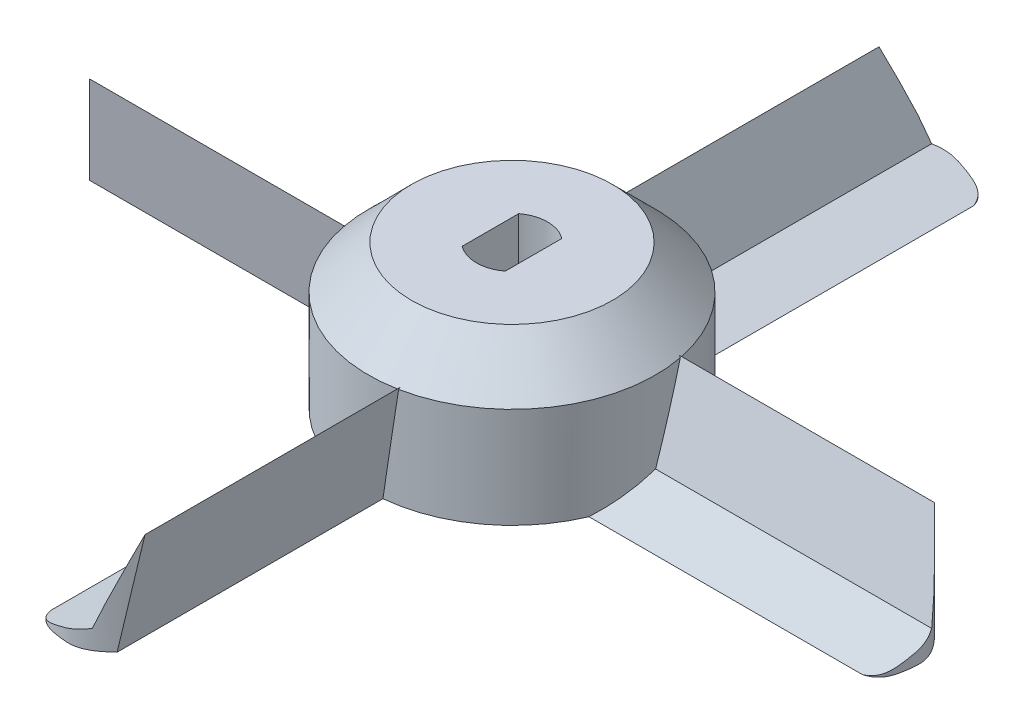
from build123d import *

# Parameters (mm, degrees)
SKETCH1_R           = 10
BOSS_EXTRUDE2_DEPTH = 10
CIRPATTERN1_COUNT   = 4
CUT_EXTRUDE3_DEPTH  = 6.15
CUT_EXTRUDE4_DEPTH  = 8.45
CIRPATTERN2_COUNT   = 4
CHAMFER1_SIZE       = 3


with BuildPart() as part:
    # Sketch1 → Boss-Extrude2 (new body)
    with BuildSketch(Plane(origin=(0, 0, 0), x_dir=(1, 0, 0), z_dir=(0, 1, 0))):
        with Locations(Location((0, 0, 0), (0, 0, 270))):
            Circle(SKETCH1_R)
    extrude(amount=BOSS_EXTRUDE2_DEPTH)

    # Sketch2 → Loft1 section 0
    with BuildSketch(Plane.XY.offset(8)):
        with BuildLine():
            Line((0, 1.334072036), (1.933158154, 7.086396301))
            Line((1.933158154, 7.086396301), (0.966579077, 0))
            Line((0.966579077, 0), (-3.866316309, 0))
            Line((-3.866316309, 0), (0, 1.334072036))
        make_face()
    # Sketch3 → Loft1 section 1
    with BuildSketch(Plane.XY.offset(30)):
        with BuildLine():
            Line((0, 1.334072036), (1.933158154, 7.086396301))
            Line((1.933158154, 7.086396301), (0.966579077, 0))
            Line((0.966579077, 0), (-3.866316309, 0))
            Line((-3.866316309, 0), (0, 1.334072036))
        make_face()
    loft1 = loft()

    # CirPattern1: Loft1 ×4 about axis
    cirpattern1_axis = Axis((0, 0, 0), (0, 1, 0))
    for i in range(1, CIRPATTERN1_COUNT):
        add(loft1.rotate(cirpattern1_axis, i * 360 / CIRPATTERN1_COUNT))

    # Sketch8 → Cut-Extrude3 (cut)
    with BuildSketch(Plane(origin=(0, 10, 0), x_dir=(1, 0, 0), z_dir=(0, 1, 0))):
        with BuildLine():
            Line((1.5, 1.968660712), (1.5, -1.968660712))
            ThreePointArc((1.5, -1.968660712), (0, -2.475), (-1.5, -1.968660712))
            Line((-1.5, -1.968660712), (-1.5, 1.968660712))
            ThreePointArc((-1.5, 1.968660712), (0, 2.475), (1.5, 1.968660712))
        make_face()
    extrude(amount=-CUT_EXTRUDE3_DEPTH, mode=Mode.SUBTRACT)

    # Sketch9 → Cut-Extrude4 (cut)
    with BuildSketch(Plane.XZ):
        with BuildLine():
            Line((28.274704093, 3.866316309), (30.023429762, 3.866316309))
            Line((30.023429762, 3.866316309), (30.023429762, -1.933158154))
            Line((30.023429762, -1.933158154), (27.489632408, -1.933158154))
            add(Edge.make_bspline(
                [(28.274704093, 3.866316309), (29.251563836, 3.579912726), (29.503721472, 2.469841159), (29.781293332, 0.089495711), (28.257519324, -1.153109295), (27.489632408, -1.933158154)],
                knots=[0, 0, 0, 0, 0.329035363, 0.48426931, 1, 1, 1, 1], degree=3))
        make_face()
    cut_extrude4 = extrude(amount=-CUT_EXTRUDE4_DEPTH, mode=Mode.SUBTRACT)

    # CirPattern2: Cut-Extrude4 ×4 about axis
    cirpattern2_axis = Axis((0, 10, 0), (0, 1, 0))
    for i in range(1, CIRPATTERN2_COUNT):
        add(cut_extrude4.rotate(cirpattern2_axis, i * 360 / CIRPATTERN2_COUNT), mode=Mode.SUBTRACT)

    # Chamfer1
    # the kernel refuses this chamfer: 3 mm, written as the material it takes off along each edge
    with BuildSketch(Plane(origin=(0, 10, 0), x_dir=(0, 0, 1), z_dir=(-1, 0, 0))) as chamfer1_piece_1_section:
        Polygon((10, -CHAMFER1_SIZE), (10 - CHAMFER1_SIZE, 0), (10, 0), align=None)
    chamfer1_piece_1 = revolve(axis=Axis((0, 10, 0), (0, 1, 0)), mode=Mode.PRIVATE)
    chamfer1_piece_1 = split(chamfer1_piece_1, bisect_by=Plane(origin=(2.324578556, 8.251110666, 8.890331171), z_dir=(-0.947903464475993, 0.3185577216681616, 0)), keep=Keep.TOP, mode=Mode.PRIVATE)
    chamfer1_piece_1 = split(chamfer1_piece_1, bisect_by=Plane(origin=(-2.324578556, 8.251110666, 8.890331171), z_dir=(0.947903464475993, 0.3185577216681616, 0)), keep=Keep.TOP, mode=Mode.PRIVATE)
    add(chamfer1_piece_1, mode=Mode.SUBTRACT)
    with BuildSketch(Plane(origin=(0, 10, 0), x_dir=(0, 0, 1), z_dir=(-1, 0, 0))) as chamfer1_piece_2_section:
        Polygon((10, -CHAMFER1_SIZE), (10 - CHAMFER1_SIZE, 0), (10, 0), align=None)
    chamfer1_piece_2 = revolve(axis=Axis((0, 10, 0), (0, 1, 0)), mode=Mode.PRIVATE)
    chamfer1_piece_2 = split(chamfer1_piece_2, bisect_by=Plane(origin=(-1.927187537, 7.042623199, 9.791355143), z_dir=(0.9908254446191594, 0.13514783866287053, 0)), keep=Keep.TOP, mode=Mode.PRIVATE)
    chamfer1_piece_2 = split(chamfer1_piece_2, bisect_by=Plane(origin=(-1.922954088, 3.507226982, -0.730322564), z_dir=(0, 0.3185577216681616, 0.947903464475993)), keep=Keep.TOP, mode=Mode.PRIVATE)
    chamfer1_piece_2 = split(chamfer1_piece_2, bisect_by=Plane(origin=(-1.919079209, 7.044502852, 9.791355143), z_dir=(-0.947903464475993, -0.3185577216681616, 0)), keep=Keep.TOP, mode=Mode.PRIVATE)
    add(chamfer1_piece_2, mode=Mode.SUBTRACT)
    with BuildSketch(Plane(origin=(0, 10, 0), x_dir=(0, 0, 1), z_dir=(-1, 0, 0))) as chamfer1_piece_3_section:
        Polygon((10, -CHAMFER1_SIZE), (10 - CHAMFER1_SIZE, 0), (10, 0), align=None)
    chamfer1_piece_3 = revolve(axis=Axis((0, 10, 0), (0, 1, 0)), mode=Mode.PRIVATE)
    chamfer1_piece_3 = split(chamfer1_piece_3, bisect_by=Plane(origin=(2.255597721, 9.450335897, 6.172482093), z_dir=(0.9908254446191594, -0.13514783866287053, 0)), keep=Keep.TOP, mode=Mode.PRIVATE)
    chamfer1_piece_3 = split(chamfer1_piece_3, bisect_by=Plane(origin=(6.172482093, 6.28280667, -1.663099344), z_dir=(0, 0.3185577216681616, 0.947903464475993)), keep=Keep.TOP, mode=Mode.PRIVATE)
    add(chamfer1_piece_3, mode=Mode.SUBTRACT)
    with BuildSketch(Plane(origin=(0, 10, 0), x_dir=(0, 0, 1), z_dir=(-1, 0, 0))) as chamfer1_piece_4_section:
        Polygon((10, -CHAMFER1_SIZE), (10 - CHAMFER1_SIZE, 0), (10, 0), align=None)
    chamfer1_piece_4 = revolve(axis=Axis((0, 10, 0), (0, 1, 0)), mode=Mode.PRIVATE)
    chamfer1_piece_4 = split(chamfer1_piece_4, bisect_by=Plane(origin=(-6.172482093, 9.450335897, 2.255597721), z_dir=(0, -0.13514783866287053, 0.9908254446191594)), keep=Keep.TOP, mode=Mode.PRIVATE)
    chamfer1_piece_4 = split(chamfer1_piece_4, bisect_by=Plane(origin=(-2.915854237, 10.010516351, 6.172482093), z_dir=(-0.947903464475993, -0.3185577216681616, 0)), keep=Keep.TOP, mode=Mode.PRIVATE)
    add(chamfer1_piece_4, mode=Mode.SUBTRACT)
    with BuildSketch(Plane(origin=(0, 10, 0), x_dir=(0, 0, 1), z_dir=(-1, 0, 0))) as chamfer1_piece_5_section:
        Polygon((10, -CHAMFER1_SIZE), (10 - CHAMFER1_SIZE, 0), (10, 0), align=None)
    chamfer1_piece_5 = revolve(axis=Axis((0, 10, 0), (0, 1, 0)), mode=Mode.PRIVATE)
    chamfer1_piece_5 = split(chamfer1_piece_5, bisect_by=Plane(origin=(-2.32080528, 9.928399838, 0), z_dir=(-0.9908254446191594, -0.13514783866287053, 0)), keep=Keep.TOP, mode=Mode.PRIVATE)
    chamfer1_piece_5 = split(chamfer1_piece_5, bisect_by=Plane(origin=(-8.890331171, 8.251110666, 2.324578556), z_dir=(0, 0.3185577216681616, -0.947903464475993)), keep=Keep.TOP, mode=Mode.PRIVATE)
    add(chamfer1_piece_5, mode=Mode.SUBTRACT)
    with BuildSketch(Plane(origin=(0, 10, 0), x_dir=(0, 0, 1), z_dir=(-1, 0, 0))) as chamfer1_piece_6_section:
        Polygon((10, -CHAMFER1_SIZE), (10 - CHAMFER1_SIZE, 0), (10, 0), align=None)
    chamfer1_piece_6 = revolve(axis=Axis((0, 10, 0), (0, 1, 0)), mode=Mode.PRIVATE)
    chamfer1_piece_6 = split(chamfer1_piece_6, bisect_by=Plane(origin=(6.172482093, 9.450335897, -2.255597721), z_dir=(0, -0.13514783866287053, -0.9908254446191594)), keep=Keep.TOP, mode=Mode.PRIVATE)
    chamfer1_piece_6 = split(chamfer1_piece_6, bisect_by=Plane(origin=(-1.663099344, 6.28280667, -6.172482093), z_dir=(0.947903464475993, 0.3185577216681616, 0)), keep=Keep.TOP, mode=Mode.PRIVATE)
    add(chamfer1_piece_6, mode=Mode.SUBTRACT)


solid = part.part
